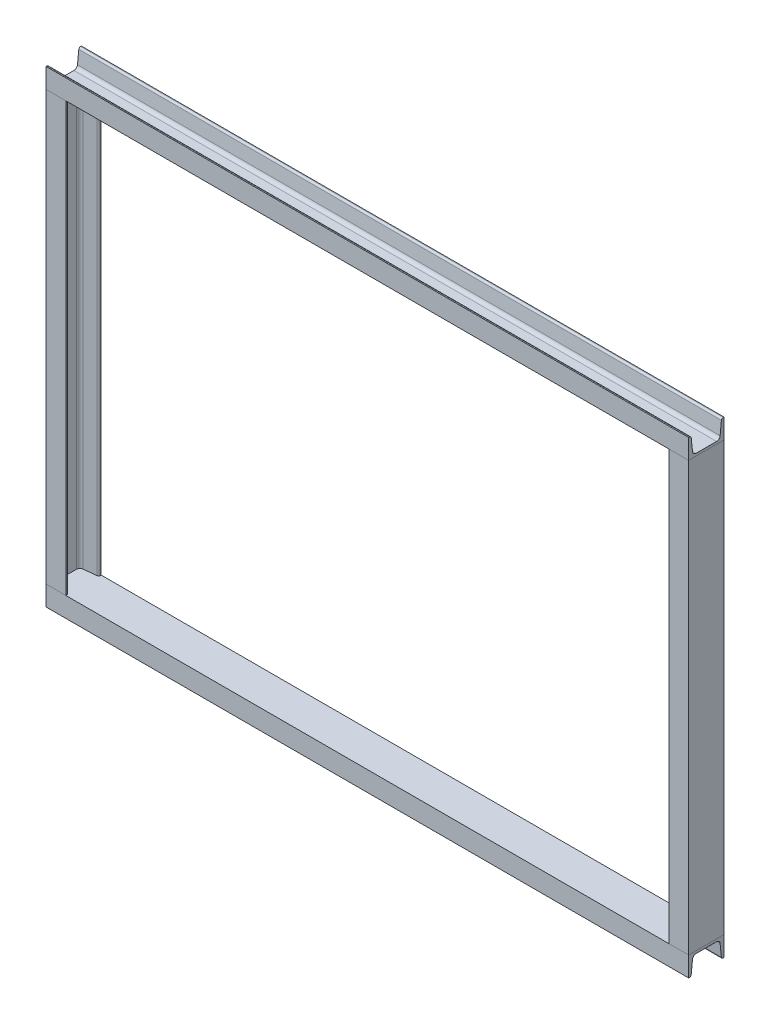
from build123d import *

# Parameters (mm, degrees)
C_START                               = -727.5
C_CHANNEL_CONFIGURED_80_X_8_1_DEPTH   = 1455
C_START_2                             = -485
C_CHANNEL_CONFIGURED_80_X_8_1_2_DEPTH = 970
CIRPATTERN1_COUNT                     = 2
CIRPATTERN1_ANGLE                     = 180


# Read off the part's stored shape, not the designer's step: C channel - configured 80 X 8(1)
with BuildPart() as part:
    # C channel - configured 80 X 8(1) outline → C channel - configured 80 X 8(1) (new body)
    with BuildSketch(Plane.YZ.offset(C_START)):
        with BuildLine():
            ThreePointArc((526.418113853, 74.199337243), (528.972579302, 75.500902399), (530, 78.177424825))
            Line((530, 78.177424825), (530, 80))
            Line((530, 80), (485, 80))
            Line((485, 80), (485, 0))
            Line((485, 0), (530, 0))
            Line((530, 0), (530, 1.822575175))
            ThreePointArc((530, 1.822575175), (528.972579302, 4.499097601), (526.418113853, 5.800662757))
            Line((526.418113853, 5.800662757), (497.663772294, 8.822865837))
            ThreePointArc((497.663772294, 8.822865837), (492.554841396, 11.425996149), (490.5, 16.779041))
            Line((490.5, 16.779041), (490.5, 63.220959))
            ThreePointArc((490.5, 63.220959), (492.554841396, 68.574003851), (497.663772294, 71.177134163))
            Line((497.663772294, 71.177134163), (526.418113853, 74.199337243))
        make_face()
    extrude(amount=C_CHANNEL_CONFIGURED_80_X_8_1_DEPTH)


with BuildPart() as body_2:
    # C channel - configured 80 X 8_1 2 outlin → C channel - configured 80 X 8_1 2 (new body)
    with BuildSketch(Plane(origin=(0, 0, 0), x_dir=(1, 0, 0), z_dir=(0, 1, 0)).offset(C_START_2)):
        with BuildLine():
            Line((-727.5, -80), (-682.5, -80))
            Line((-682.5, -80), (-682.5, -78.177424825))
            ThreePointArc((-682.5, -78.177424825), (-683.527420698, -75.500902399), (-686.081886147, -74.199337243))
            Line((-686.081886147, -74.199337243), (-714.836227706, -71.177134163))
            ThreePointArc((-714.836227706, -71.177134163), (-719.945158604, -68.574003851), (-722, -63.220959))
            Line((-722, -63.220959), (-722, -16.779041))
            ThreePointArc((-722, -16.779041), (-719.945158604, -11.425996149), (-714.836227706, -8.822865837))
            Line((-714.836227706, -8.822865837), (-686.081886147, -5.800662757))
            ThreePointArc((-686.081886147, -5.800662757), (-683.527420698, -4.499097601), (-682.5, -1.822575175))
            Line((-682.5, -1.822575175), (-682.5, 0))
            Line((-682.5, 0), (-727.5, 0))
            Line((-727.5, 0), (-727.5, -80))
        make_face()
    extrude(amount=C_CHANNEL_CONFIGURED_80_X_8_1_2_DEPTH)


with BuildPart() as cirpattern1_1:
    # CirPattern1: pattern copy
    add(part.part.rotate(Axis((0, 0, 0), (0, 0, 1)), 1 * CIRPATTERN1_ANGLE / (CIRPATTERN1_COUNT - 1)))


with BuildPart() as cirpattern1_2:
    # CirPattern1: pattern copy
    add(body_2.part.rotate(Axis((0, 0, 0), (0, 0, 1)), 1 * CIRPATTERN1_ANGLE / (CIRPATTERN1_COUNT - 1)))


solid = Compound([part.part, body_2.part, cirpattern1_1.part, cirpattern1_2.part])
